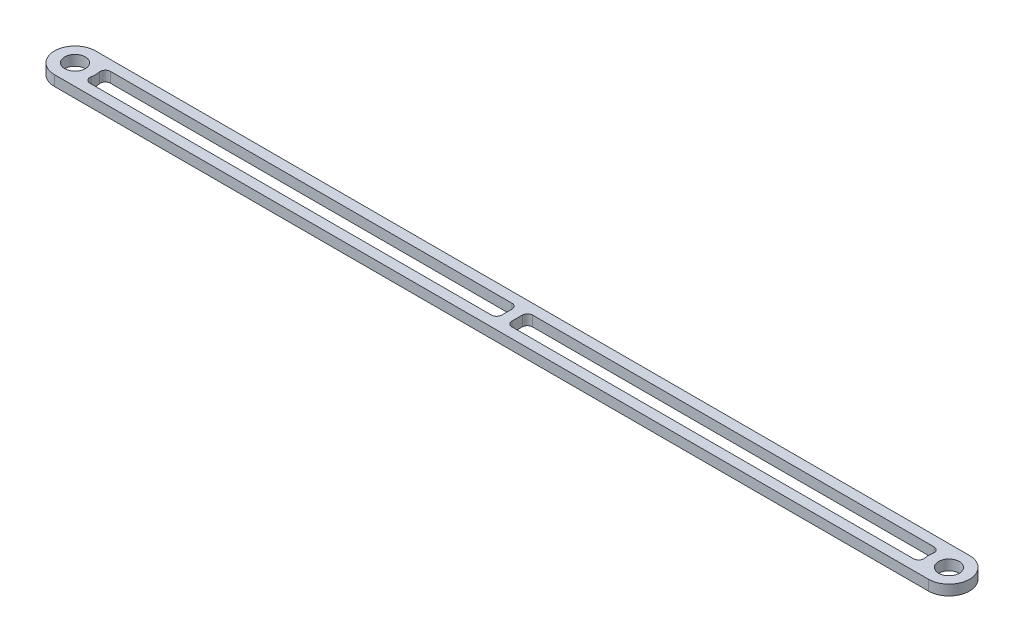
from build123d import *

# Parameters (mm, degrees)
SKETCH1_R           = 2
BOSS_EXTRUDE1_DEPTH = 2
FILLET1_R           = 1


with BuildPart() as part:
    # Sketch1 → Boss-Extrude1 (new body)
    with BuildSketch(Plane(origin=(0, 0, 0), x_dir=(1, 0, 0), z_dir=(0, 1, 0))):
        with BuildLine():
            ThreePointArc((0, 4), (-4, 0), (0, -4))
            Line((0, -4), (170, -4))
            ThreePointArc((170, -4), (174, 0), (170, 4))
            Line((170, 4), (0, 4))
        make_face()
        Circle(SKETCH1_R, mode=Mode.SUBTRACT)
        with BuildLine():
            Line((86, 2), (166.535898385, 2))
            ThreePointArc((166.535898385, 2), (166, 0), (166.535898385, -2))
            Line((166.535898385, -2), (86, -2))
            Line((86, -2), (86, 2))
        make_face(mode=Mode.SUBTRACT)
        with BuildLine():
            Line((3.464101615, 2), (84, 2))
            Line((84, 2), (84, -2))
            Line((84, -2), (3.464101615, -2))
            ThreePointArc((3.464101615, -2), (4, 0), (3.464101615, 2))
        make_face(mode=Mode.SUBTRACT)
        with Locations((170, 0)):
            Circle(SKETCH1_R, mode=Mode.SUBTRACT)
    extrude(amount=BOSS_EXTRUDE1_DEPTH)

    # Fillet1
    fillet1_edges = [part.edges().sort_by_distance(p)[0] for p in [
        (166.535898385, 1, 2),
        (166.535898385, 1, -2),
        (84, 1, 2),
        (86, 1, 2),
        (84, 1, -2),
        (86, 1, -2),
        (3.464101615, 1, 2),
        (3.464101615, 1, -2),
    ]]
    fillet(fillet1_edges, radius=FILLET1_R)


solid = part.part
